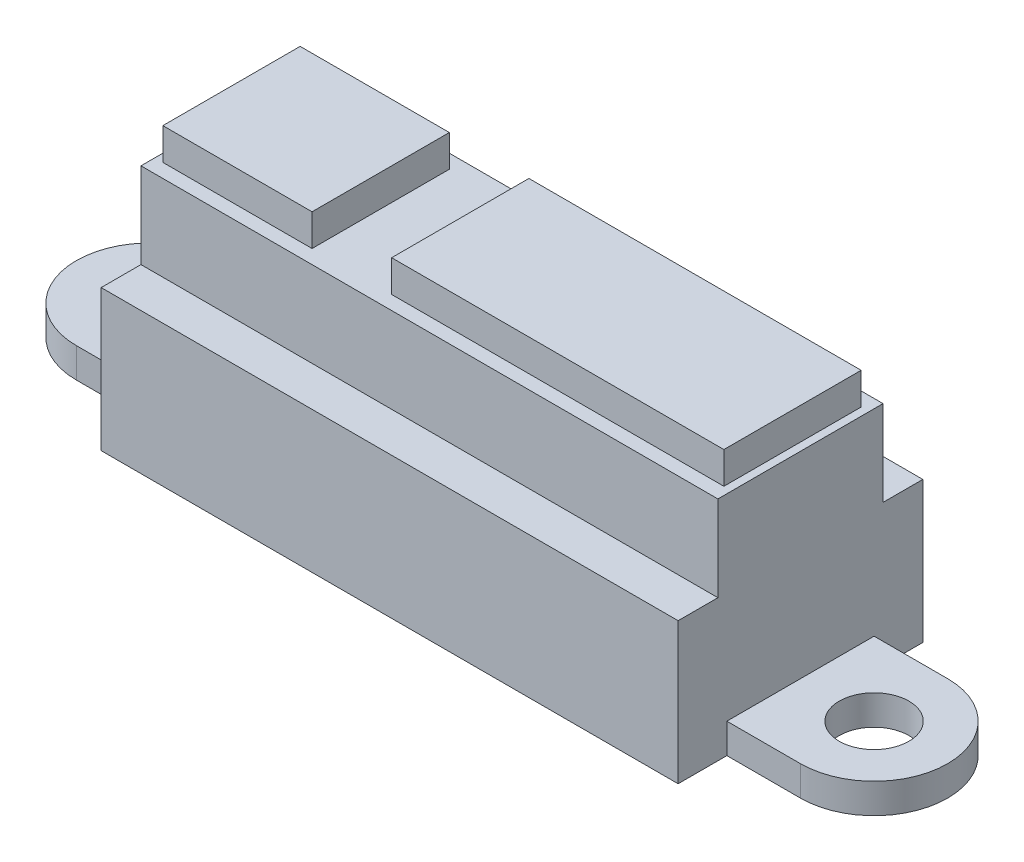
from build123d import *

# Parameters (mm, degrees)
RESSALTO_EXTRUS_O1_DEPTH = 12.3
ESBO_O2_R                = 1.75
CORTE_EXTRUS_O1_DEPTH    = 22.3
CORTE_EXTRUS_O2_DEPTH    = 32.3


with BuildPart() as part:
    # Esboço1 → Ressalto-extrusão1 (new body)
    with BuildSketch(Plane.XY):
        Polygon((-14.1, 13), (-14.1, 11.4), (-14.5, 11.4), (-14.5, 1.5), (-21.9, 1.5), (-21.9, 0), (-14.5, 0), (14.5, 0), (21.9, 0), (21.9, 1.5), (14.5, 1.5), (14.5, 11.4), (14.1, 11.4), (14.1, 13), (-2.6, 13), (-2.6, 11.4), (-6.6, 11.4), (-6.6, 13), align=None)
    extrude(amount=RESSALTO_EXTRUS_O1_DEPTH)

    # Esboço2 → Corte-extrusão1 (cut)
    with BuildSketch(Plane(origin=(0, 13, 0), x_dir=(1, 0, 0), z_dir=(0, 1, 0))):
        with BuildLine():
            ThreePointArc((-21.9, -6.15), (-20.81629509, -3.53370491), (-18.2, -2.45))
            Line((-18.2, -2.45), (-14.5, -2.45))
            Line((-14.5, -2.45), (-14.5, 0))
            Line((-14.5, 0), (-21.9, 0))
            Line((-21.9, 0), (-21.9, -6.15))
        make_face()
        with BuildLine():
            ThreePointArc((-18.2, -9.85), (-20.81629509, -8.76629509), (-21.9, -6.15))
            Line((-21.9, -6.15), (-21.9, -12.3))
            Line((-21.9, -12.3), (-14.5, -12.3))
            Line((-14.5, -12.3), (-14.5, -9.85))
            Line((-14.5, -9.85), (-18.2, -9.85))
        make_face()
        with BuildLine():
            ThreePointArc((18.2, -2.45), (20.81629509, -3.53370491), (21.9, -6.15))
            Line((21.9, -6.15), (21.9, 0))
            Line((21.9, 0), (14.5, 0))
            Line((14.5, 0), (14.5, -2.45))
            Line((14.5, -2.45), (18.2, -2.45))
        make_face()
        with BuildLine():
            Line((14.5, -12.3), (21.9, -12.3))
            Line((21.9, -12.3), (21.9, -6.15))
            ThreePointArc((21.9, -6.15), (20.81629509, -8.76629509), (18.2, -9.85))
            Line((18.2, -9.85), (14.5, -9.85))
            Line((14.5, -9.85), (14.5, -12.3))
        make_face()
        with Locations((-18.2, -6.15)):
            Circle(ESBO_O2_R)
        with Locations((18.2, -6.15)):
            Circle(ESBO_O2_R)
    extrude(amount=-CORTE_EXTRUS_O1_DEPTH, mode=Mode.SUBTRACT)

    # Esboço3 → Corte-extrusão2 (cut)
    with BuildSketch(Plane.ZY.offset(14.5)):
        Polygon((2.7, 13), (2.7, 11.4), (2, 11.4), (2, 7.1), (0, 7.1), (0, 13), align=None)
        Polygon((12.3, 13), (12.3, 7.1), (10.3, 7.1), (10.3, 11.4), (9.6, 11.4), (9.6, 13), align=None)
    extrude(amount=-CORTE_EXTRUS_O2_DEPTH, mode=Mode.SUBTRACT)


solid = part.part
